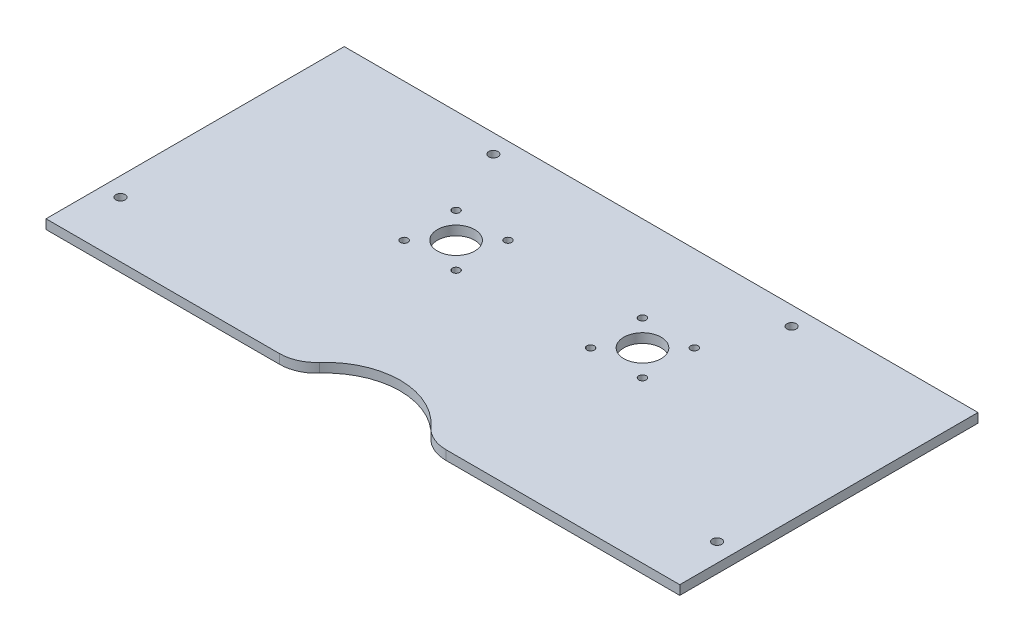
from build123d import *

# Parameters (mm, degrees)
BOSS_EXTRUDE1_DEPTH = 3.175
SKETCH2_R           = 6.35
CUT_EXTRUDE1_DEPTH  = 315.453256661
FILLET1_R           = 12.7
SKETCH3_R           = 1.27
CUT_EXTRUDE2_DEPTH  = 315.453256661
SKETCH4_R           = 1.5875
CUT_EXTRUDE3_DEPTH  = 315.453256661


with BuildPart() as part:
    # Sketch1 → Boss-Extrude1 (new body)
    with BuildSketch(Plane(origin=(0, 0, 0), x_dir=(1, 0, 0), z_dir=(0, 1, 0))):
        with BuildLine():
            Line((0, 228.6), (0, 127))
            Line((0, 127), (85.952954744, 127))
            ThreePointArc((85.952954744, 127), (107.95, 139.7), (129.947045256, 127))
            Line((129.947045256, 127), (215.9, 127))
            Line((215.9, 127), (215.9, 228.6))
            Line((215.9, 228.6), (0, 228.6))
        make_face()
    extrude(amount=BOSS_EXTRUDE1_DEPTH)

    # Sketch2 → Cut-Extrude1 (cut, through all)
    with BuildSketch(Plane(origin=(0, 3.175, 0), x_dir=(1, 0, 0), z_dir=(0, 1, 0))):
        with Locations((76.2, 190.5)):
            Circle(SKETCH2_R)
        with Locations((139.7, 190.5)):
            Circle(SKETCH2_R)
    extrude(amount=-CUT_EXTRUDE1_DEPTH, mode=Mode.SUBTRACT)

    # Fillet1
    fillet1_edges = [part.edges().sort_by_distance(p)[0] for p in [
        (129.947045256, 1.5875, -127),
        (85.952954744, 1.5875, -127),
    ]]
    fillet(fillet1_edges, radius=FILLET1_R)

    # Sketch3 → Cut-Extrude2 (cut, through all)
    with BuildSketch(Plane(origin=(0, 3.175, 0), x_dir=(1, 0, 0), z_dir=(0, 1, 0))):
        with Locations((85.038834765, 199.338834765)):
            Circle(SKETCH3_R)
        with Locations((67.361165235, 181.661165235)):
            Circle(SKETCH3_R)
        with Locations((67.361165235, 199.338834765)):
            Circle(SKETCH3_R)
        with Locations((85.038834765, 181.661165235)):
            Circle(SKETCH3_R)
        with Locations((130.861165235, 181.661165235)):
            Circle(SKETCH3_R)
        with Locations((148.538834765, 181.661165235)):
            Circle(SKETCH3_R)
        with Locations((148.538834765, 199.338834765)):
            Circle(SKETCH3_R)
        with Locations((130.861165235, 199.338834765)):
            Circle(SKETCH3_R)
    extrude(amount=-CUT_EXTRUDE2_DEPTH, mode=Mode.SUBTRACT)

    # Sketch4 → Cut-Extrude3 (cut, through all)
    with BuildSketch(Plane(origin=(0, 3.175, 0), x_dir=(1, 0, 0), z_dir=(0, 1, 0))):
        with Locations((6.35, 146.05)):
            Circle(SKETCH4_R)
        with Locations((57.15, 222.25)):
            Circle(SKETCH4_R)
        with Locations((158.75, 222.25)):
            Circle(SKETCH4_R)
        with Locations((209.55, 146.05)):
            Circle(SKETCH4_R)
    extrude(amount=-CUT_EXTRUDE3_DEPTH, mode=Mode.SUBTRACT)


solid = part.part
